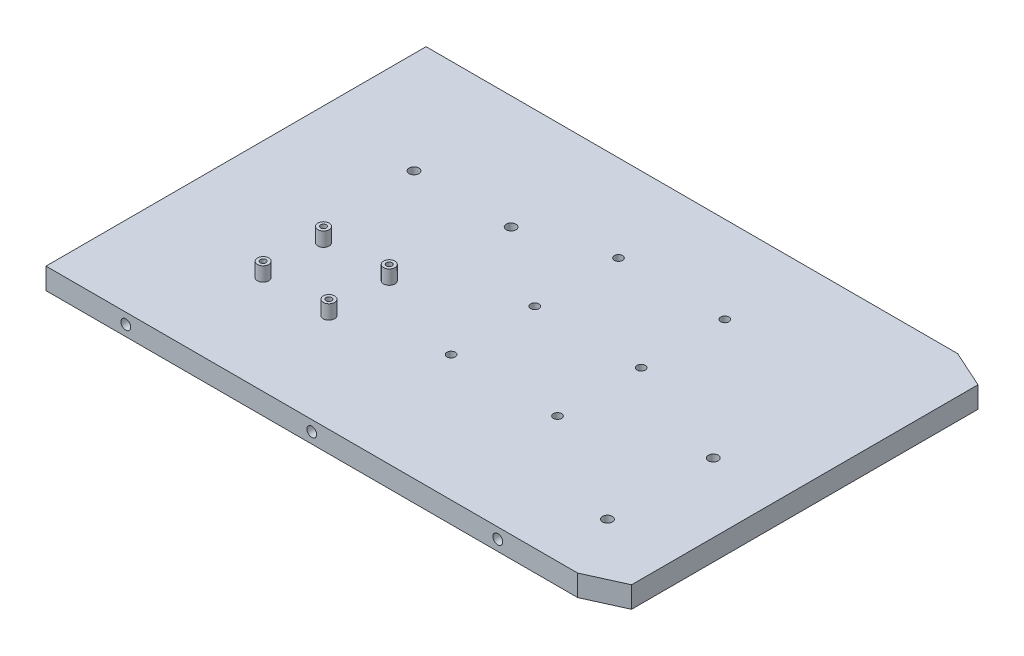
from build123d import *

# Parameters (mm, degrees)
BOSS_EXTRUDE1_DEPTH   = 10
SKETCH2_R             = 2.925
SKETCH2_R_2           = 3.455
SKETCH2_R_3           = 3.45
BOSS_EXTRUDE3_DEPTH   = 5
SKETCH3_R             = 4
SKETCH3_R_2           = 2
BOSS_EXTRUDE4_DEPTH   = 10
BOSS_EXTRUDE4_2_DEPTH = 10
BOSS_EXTRUDE4_3_DEPTH = 10
BOSS_EXTRUDE4_4_DEPTH = 10
SKETCH4_W             = 374.81
SKETCH4_H             = 15
SKETCH4_R             = 3.455
BOSS_EXTRUDE5_DEPTH   = 5.7
BOSS_EXTRUDE6_START   = 5.7
SKETCH5_W             = 374.81
SKETCH5_H             = 15
SKETCH5_R             = 3.455
BOSS_EXTRUDE6_DEPTH   = 5.7


with BuildPart() as part:
    # Sketch1 → Boss-Extrude1 (new body)
    with BuildSketch(Plane(origin=(0, 0, 0), x_dir=(1, 0, 0), z_dir=(0, 1, 0))):
        Polygon((0, 12.033084577), (0, 268.596915423), (374.81, 268.596915423), (374.81, 274.296915423), (401.01, 262.445), (401.01, 18.185), (374.81, 6.333084577), (374.81, 12.033084577), align=None)
    extrude(amount=BOSS_EXTRUDE1_DEPTH)



with BuildPart() as body_2:
    # Sketch2 → Boss-Extrude3 (new body)
    with BuildSketch(Plane(origin=(0, 10, 0), x_dir=(1, 0, 0), z_dir=(0, 1, 0))):
        Polygon((374.81, 268.596915423), (0, 268.596915423), (0, 12.033084577), (374.81, 12.033084577), (374.81, 6.333084577), (401.01, 18.185), (401.01, 262.445), (374.81, 274.296915423), align=None)
        with Locations((196.849938773, 95.119737674)):
            Circle(SKETCH2_R, mode=Mode.SUBTRACT)
        with Locations((352.434052915, 49.730316665)):
            Circle(SKETCH2_R_2, mode=Mode.SUBTRACT)
        with Locations((271.849938773, 95.119737674)):
            Circle(SKETCH2_R, mode=Mode.SUBTRACT)
        with Locations((352.434052915, 124.380316665)):
            Circle(SKETCH2_R_2, mode=Mode.SUBTRACT)
        with Locations((71.582925509, 194.209025808)):
            Circle(SKETCH2_R_3, mode=Mode.SUBTRACT)
        with Locations((196.849938773, 154.119737674)):
            Circle(SKETCH2_R, mode=Mode.SUBTRACT)
        with Locations((140.082925509, 194.209025808)):
            Circle(SKETCH2_R_3, mode=Mode.SUBTRACT)
        with Locations((196.849938773, 213.119737674)):
            Circle(SKETCH2_R, mode=Mode.SUBTRACT)
        with Locations((271.849938773, 154.119737674)):
            Circle(SKETCH2_R, mode=Mode.SUBTRACT)
        with Locations((271.849938773, 213.119737674)):
            Circle(SKETCH2_R, mode=Mode.SUBTRACT)
    extrude(amount=BOSS_EXTRUDE3_DEPTH)


with BuildPart() as body_3:
    # Sketch3 → Boss-Extrude4 (new body)
    with BuildSketch(Plane(origin=(0, 15, 0), x_dir=(1, 0, 0), z_dir=(0, 1, 0))):
        with Locations((83.569887603, 75.881235755)):
            Circle(SKETCH3_R)
        with Locations((83.569887603, 75.881235755)):
            Circle(SKETCH3_R_2, mode=Mode.SUBTRACT)
    extrude(amount=BOSS_EXTRUDE4_DEPTH)


with BuildPart() as body_4:
    # Sketch3 → Boss-Extrude4 2 (new body)
    with BuildSketch(Plane(origin=(0, 15, 0), x_dir=(1, 0, 0), z_dir=(0, 1, 0))):
        with Locations((83.569887603, 118.426235755)):
            Circle(SKETCH3_R)
        with Locations((83.569887603, 118.426235755)):
            Circle(SKETCH3_R_2, mode=Mode.SUBTRACT)
    extrude(amount=BOSS_EXTRUDE4_2_DEPTH)


with BuildPart() as body_5:
    # Sketch3 → Boss-Extrude4 3 (new body)
    with BuildSketch(Plane(origin=(0, 15, 0), x_dir=(1, 0, 0), z_dir=(0, 1, 0))):
        with Locations((129.924887603, 118.426235755)):
            Circle(SKETCH3_R)
        with Locations((129.924887603, 118.426235755)):
            Circle(SKETCH3_R_2, mode=Mode.SUBTRACT)
    extrude(amount=BOSS_EXTRUDE4_3_DEPTH)


with BuildPart() as body_6:
    # Sketch3 → Boss-Extrude4 4 (new body)
    with BuildSketch(Plane(origin=(0, 15, 0), x_dir=(1, 0, 0), z_dir=(0, 1, 0))):
        with Locations((129.924887603, 75.881235755)):
            Circle(SKETCH3_R)
        with Locations((129.924887603, 75.881235755)):
            Circle(SKETCH3_R_2, mode=Mode.SUBTRACT)
    extrude(amount=BOSS_EXTRUDE4_4_DEPTH)


with BuildPart() as part_1:
    add(part.part)

    add(body_2.part)  # Boss-Extrude5 merges body 2
    # Sketch4 → Boss-Extrude5 (add)
    with BuildSketch(Plane.XY.offset(-12.033084577)):
        with Locations((187.405, 7.5)):
            Rectangle(SKETCH4_W, SKETCH4_H)
        with Locations((187.405, 7.5)):
            Circle(SKETCH4_R, mode=Mode.SUBTRACT)
        with Locations((56.269425864, 7.5)):
            Circle(SKETCH4_R, mode=Mode.SUBTRACT)
        with Locations((318.540574136, 7.5)):
            Circle(SKETCH4_R, mode=Mode.SUBTRACT)
    extrude(amount=BOSS_EXTRUDE5_DEPTH)

    # Sketch5 → Boss-Extrude6 (add)
    with BuildSketch(Plane(origin=(0, 0, -268.596915423), x_dir=(-1, 0, 0), z_dir=(0, 0, -1)).offset(BOSS_EXTRUDE6_START)):
        with Locations((-187.405, 7.5)):
            Rectangle(SKETCH5_W, SKETCH5_H)
        with Locations((-187.405, 7.5)):
            Circle(SKETCH5_R, mode=Mode.SUBTRACT)
        with Locations((-318.540574136, 7.5)):
            Circle(SKETCH5_R, mode=Mode.SUBTRACT)
        with Locations((-56.269425864, 7.5)):
            Circle(SKETCH5_R, mode=Mode.SUBTRACT)
    extrude(amount=-BOSS_EXTRUDE6_DEPTH)


solid = Compound([body_3.part, body_4.part, body_5.part, body_6.part, part_1.part])
